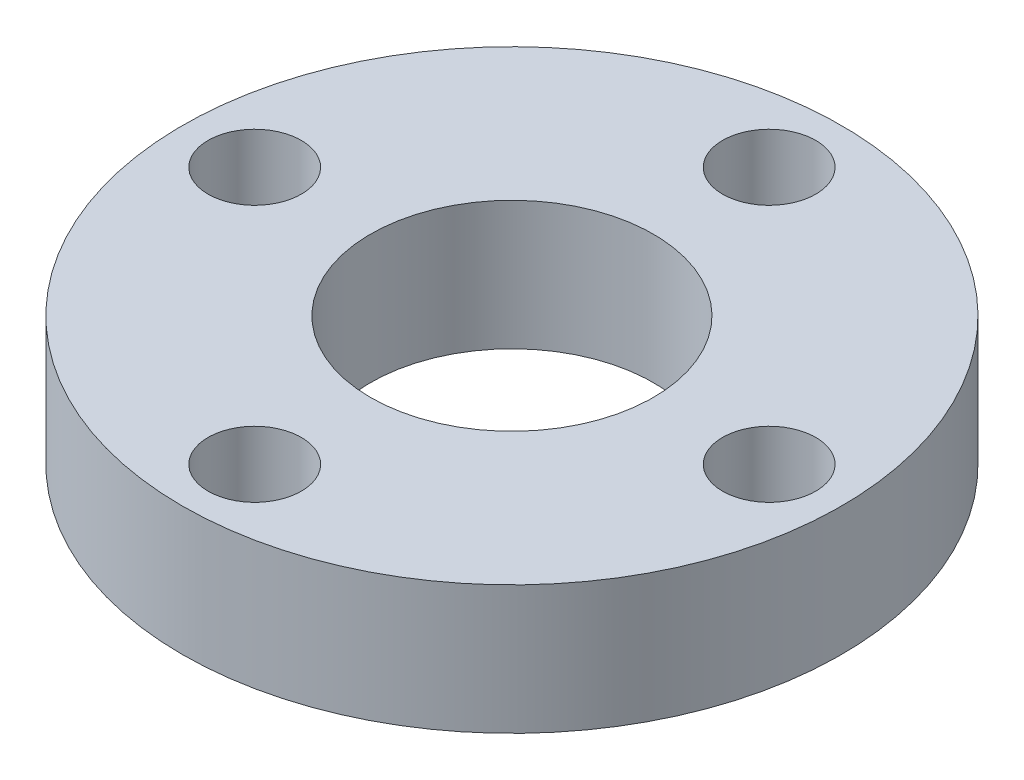
from build123d import *

# Parameters (mm, degrees)
SKETCH1_R           = 10.25
SKETCH1_R_2         = 1.45
SKETCH1_R_3         = 4.4
BOSS_EXTRUDE1_DEPTH = 4


with BuildPart() as part:
    # Sketch1 → Boss-Extrude1 (new body)
    with BuildSketch(Plane(origin=(0, 0, 0), x_dir=(1, 0, 0), z_dir=(0, 1, 0))):
        Circle(SKETCH1_R)
        with Locations((0, 8)):
            Circle(SKETCH1_R_2, mode=Mode.SUBTRACT)
        with Locations((-8, 0)):
            Circle(SKETCH1_R_2, mode=Mode.SUBTRACT)
        with Locations((0, -8)):
            Circle(SKETCH1_R_2, mode=Mode.SUBTRACT)
        with Locations((8, 0)):
            Circle(SKETCH1_R_2, mode=Mode.SUBTRACT)
        Circle(SKETCH1_R_3, mode=Mode.SUBTRACT)
    extrude(amount=BOSS_EXTRUDE1_DEPTH)


solid = part.part
